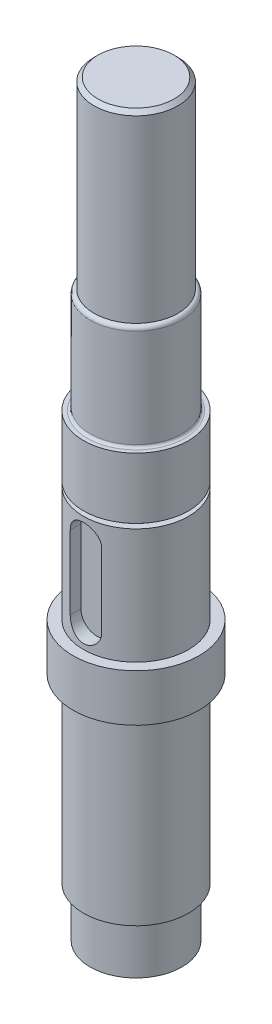
from build123d import *

# Parameters (mm, degrees)
CHAMFER1_SIZE      = 1.5
FILLET2_R          = 1.5
CUT_EXTRUDE1_DEPTH = 5
CUT_EXTRUDE2_DEPTH = 5
FILLET4_R          = 1


with BuildPart() as part:
    # Sketch1 → Revolve1 (revolve)
    with BuildSketch(Plane.XY):
        Polygon((0, 0), (17.5, 0), (17.5, 19), (20, 19), (20, 88), (24, 88), (24, 106), (20, 106), (20, 150), (17.5, 150), (17.5, 151.8), (20, 151.8), (20, 175), (17.5, 175), (17.5, 215), (16, 215), (16, 285), (0, 285), align=None)
    revolve(axis=Axis((0, 0, 0), (0, 1, 0)))

    # Chamfer1
    chamfer1_edges = [part.edges().sort_by_distance(p)[0] for p in [
        (-16, 285, 0),
    ]]
    chamfer(chamfer1_edges, length=CHAMFER1_SIZE)

    # Fillet2
    fillet2_edges = [part.edges().sort_by_distance(p)[0] for p in [
        (-17.5, 215, 0),
    ]]
    fillet(fillet2_edges, radius=FILLET2_R - 0.0001)  # a hair under: the kernel refuses the full size

    # Sketch3 → Cut-Extrude1 (cut)
    with BuildSketch(Plane.XY.offset(20)):
        with BuildLine():
            Line((6, 142), (6, 114))
            ThreePointArc((6, 114), (0, 108), (-6, 114))
            Line((-6, 114), (-6, 142))
            ThreePointArc((-6, 142), (0, 148), (6, 142))
        make_face()
    extrude(amount=-CUT_EXTRUDE1_DEPTH, mode=Mode.SUBTRACT)

    # Sketch4 → Cut-Extrude2 (cut)
    with BuildSketch(Plane(origin=(-16, 0, 0), x_dir=(0, 0, -1), z_dir=(1, 0, 0))):
        with BuildLine():
            Line((10, 267.5), (10, 237.5))
            ThreePointArc((10, 237.5), (0, 227.5), (-10, 237.5))
            Line((-10, 237.5), (-10, 267.5))
            ThreePointArc((-10, 267.5), (0, 277.5), (10, 267.5))
        make_face()
    extrude(amount=CUT_EXTRUDE2_DEPTH, mode=Mode.SUBTRACT)

    # Fillet4
    fillet4_edges = [part.edges().sort_by_distance(p)[0] for p in [
        (-17.5, 175, 0),
    ]]
    fillet(fillet4_edges, radius=FILLET4_R)


solid = part.part
